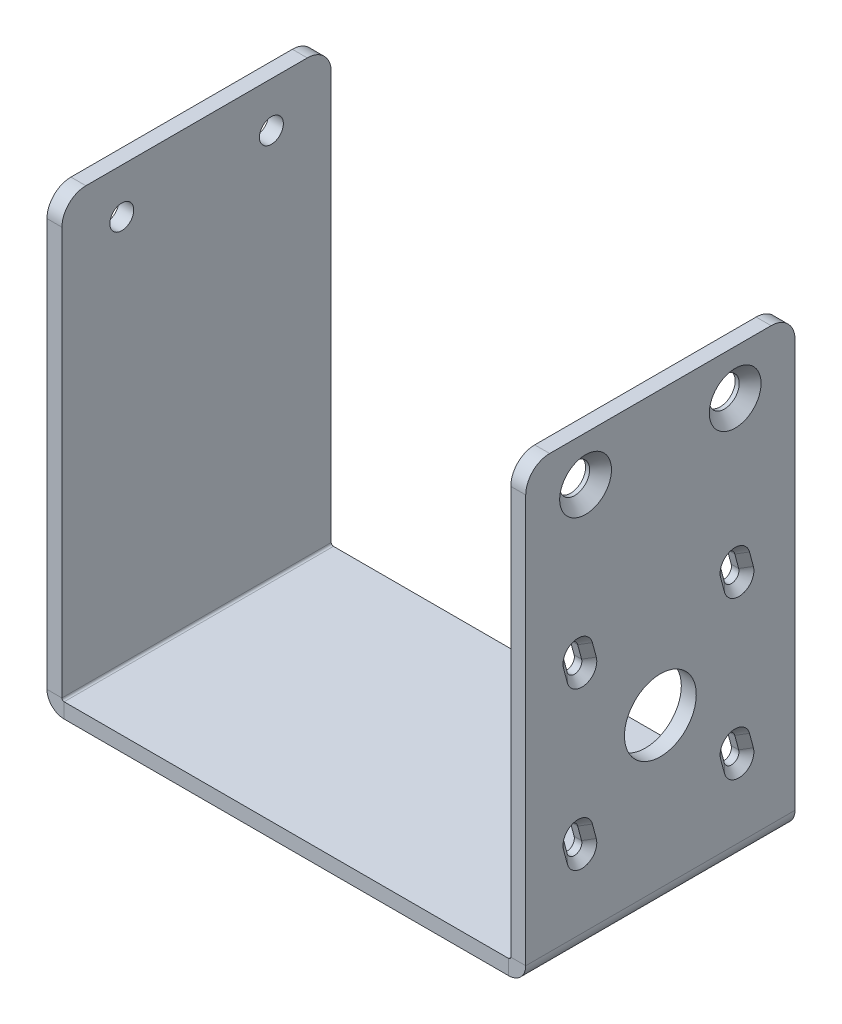
from build123d import *

# Parameters (mm, degrees)
SKETCH5_W                                       = 160
SKETCH5_H                                       = 90
BASE_FLANGE1_DEPTH                              = 5
EDGE_FLANGE1_STRIP_W                            = 21.4732
EDGE_FLANGE1_STRIP_H                            = 5
EDGE_FLANGE1_STRIP_CUT_DEPTH                    = 90
EDGE_FLANGE1_STRIP_2_W                          = 21.4732
EDGE_FLANGE1_STRIP_2_H                          = 5
EDGE_FLANGE1_STRIP_CUT_2_DEPTH                  = 90
EDGE_FLANGE1_DEPTH                              = 90
EDGE_FLANGE1_BEND_DEPTH                         = 90
CUT_EXTRUDE1_REACH                              = 235.934
SKETCH16_R                                      = 12
SKETCH16_R_2                                    = 4
CUT_EXTRUDE2_REACH                              = 232.543
SKETCH20_R                                      = 4
CSK_FOR_M8_FLAT_HEAD_MACHINE_SCREW1_D           = 10
CSK_FOR_M8_FLAT_HEAD_MACHINE_SCREW1_DEPTH       = 10.25
CSK_FOR_M8_FLAT_HEAD_MACHINE_SCREW1_CSINK_D     = 17.3
CSK_FOR_M8_FLAT_HEAD_MACHINE_SCREW1_CSINK_ANGLE = 90
CSK_FOR_M8_FLAT_HEAD_MACHINE_SCREW1_TIP         = 3.004303095
BREAK_CORNER1_DEPTH                             = 160
CHAMFER2_SIZE                                   = 2.5


# Read off the part's stored shape, not the designer's step: Break-Corner1
# Sheet-metal steps are written as plain solids
with BuildPart() as part:
    # Sketch5 → Base-Flange1 (new body)
    with BuildSketch(Plane(origin=(0, 0, 0), x_dir=(1, 0, 0), z_dir=(0, 1, 0))):
        with Locations((80, 45)):
            Rectangle(SKETCH5_W, SKETCH5_H)
    extrude(amount=-BASE_FLANGE1_DEPTH)

    # Edge-Flange1 strip (across the edge) → Edge-Flange1 strip cut (cut)
    with BuildSketch(Plane.XY.offset(-90)):
        with Locations((-5, -2.5)):
            Rectangle(EDGE_FLANGE1_STRIP_W, EDGE_FLANGE1_STRIP_H)
    extrude(amount=EDGE_FLANGE1_STRIP_CUT_DEPTH, mode=Mode.SUBTRACT)

    # Edge-Flange1 strip 2 (across the edge) → Edge-Flange1 strip cut 2 (cut)
    with BuildSketch(Plane(origin=(160, 0, 0), x_dir=(-1, 0, 0), z_dir=(0, 0, -1))):
        with Locations((-5, -2.5)):
            Rectangle(EDGE_FLANGE1_STRIP_2_W, EDGE_FLANGE1_STRIP_2_H)
    extrude(amount=EDGE_FLANGE1_STRIP_CUT_2_DEPTH, mode=Mode.SUBTRACT)

    # Edge-Flange1 section (across the edge) → Edge-Flange1 (add)
    with BuildSketch(Plane.XY.offset(-90)):
        with BuildLine():
            Line((0, 0.7366), (0, 145))
            Line((0, 145), (5, 145))
            Line((5, 145), (5, 0.7366))
            ThreePointArc((5, 0.7366), (5.215745145, 0.215745145), (5.7366, 0))
            Line((5.7366, 0), (5.7366, -5))
            ThreePointArc((5.7366, -5), (1.680211239, -3.319788761), (0, 0.7366))
        make_face()
    extrude(amount=EDGE_FLANGE1_DEPTH)

    # Edge-Flange1 section 2 (across the edge) → Edge-Flange1 bend (add)
    with BuildSketch(Plane(origin=(160, 0, 0), x_dir=(-1, 0, 0), z_dir=(0, 0, -1))):
        with BuildLine():
            Line((0, 0.7366), (0, 145))
            Line((0, 145), (5, 145))
            Line((5, 145), (5, 0.7366))
            ThreePointArc((5, 0.7366), (5.215745145, 0.215745145), (5.7366, 0))
            Line((5.7366, 0), (5.7366, -5))
            ThreePointArc((5.7366, -5), (1.680211239, -3.319788761), (0, 0.7366))
        make_face()
    extrude(amount=EDGE_FLANGE1_BEND_DEPTH)

    # Sketch16 → Cut-Extrude1 (cut, up to next)
    with BuildSketch(Plane(origin=(160, 0, 0), x_dir=(0, 0, -1), z_dir=(1, 0, 0)), mode=Mode.PRIVATE) as cut_extrude1_sk1:
        with Locations(Location((45, 50.7366, 0), (0, 0, 90))):
            Circle(SKETCH16_R)
    cut_extrude1_tool1 = extrude(cut_extrude1_sk1.sketch, amount=-CUT_EXTRUDE1_REACH, mode=Mode.PRIVATE) & part.part
    # Sketch16 → Cut-Extrude1 (cut, up to next)
    with BuildSketch(Plane(origin=(160, 0, 0), x_dir=(0, 0, -1), z_dir=(1, 0, 0)), mode=Mode.PRIVATE) as cut_extrude1_sk2:
        with Locations(Location((20, 130, 0), (0, 0, 90))):
            Circle(SKETCH16_R_2)
    cut_extrude1_tool2 = extrude(cut_extrude1_sk2.sketch, amount=-CUT_EXTRUDE1_REACH, mode=Mode.PRIVATE) & part.part
    # Sketch16 → Cut-Extrude1 (cut, up to next)
    with BuildSketch(Plane(origin=(160, 0, 0), x_dir=(0, 0, -1), z_dir=(1, 0, 0)), mode=Mode.PRIVATE) as cut_extrude1_sk3:
        with Locations(Location((70, 130, 0), (0, 0, 270))):
            Circle(SKETCH16_R_2)
    cut_extrude1_tool3 = extrude(cut_extrude1_sk3.sketch, amount=-CUT_EXTRUDE1_REACH, mode=Mode.PRIVATE) & part.part
    # Sketch16 → Cut-Extrude1 (cut, up to next)
    with BuildSketch(Plane(origin=(160, 0, 0), x_dir=(0, 0, -1), z_dir=(1, 0, 0)), mode=Mode.PRIVATE) as cut_extrude1_sk4:
        with BuildLine():
            Line((16.334822748, 23.840907472), (15.043437692, 28.671261976))
            ThreePointArc((15.043437692, 28.671261976), (16.812922416, 31.732131756), (19.873792196, 29.962647032))
            Line((19.873792196, 29.962647032), (21.165177252, 25.132292528))
            ThreePointArc((21.165177252, 25.132292528), (19.395692528, 22.071422748), (16.334822748, 23.840907472))
        make_face()
    cut_extrude1_tool4 = extrude(cut_extrude1_sk4.sketch, amount=-CUT_EXTRUDE1_REACH, mode=Mode.PRIVATE) & part.part
    # Sketch16 → Cut-Extrude1 (cut, up to next)
    with BuildSketch(Plane(origin=(160, 0, 0), x_dir=(0, 0, -1), z_dir=(1, 0, 0)), mode=Mode.PRIVATE) as cut_extrude1_sk5:
        with BuildLine():
            Line((68.834822748, 23.840907472), (67.543437692, 28.671261976))
            ThreePointArc((67.543437692, 28.671261976), (69.312922416, 31.732131756), (72.373792196, 29.962647032))
            Line((72.373792196, 29.962647032), (73.665177252, 25.132292528))
            ThreePointArc((73.665177252, 25.132292528), (71.895692528, 22.071422748), (68.834822748, 23.840907472))
        make_face()
    cut_extrude1_tool5 = extrude(cut_extrude1_sk5.sketch, amount=-CUT_EXTRUDE1_REACH, mode=Mode.PRIVATE) & part.part
    # Sketch16 → Cut-Extrude1 (cut, up to next)
    with BuildSketch(Plane(origin=(160, 0, 0), x_dir=(0, 0, -1), z_dir=(1, 0, 0)), mode=Mode.PRIVATE) as cut_extrude1_sk6:
        with BuildLine():
            Line((16.334822748, 76.340907472), (15.043437692, 81.171261976))
            ThreePointArc((15.043437692, 81.171261976), (16.812922416, 84.232131756), (19.873792196, 82.462647032))
            Line((19.873792196, 82.462647032), (21.165177252, 77.632292528))
            ThreePointArc((21.165177252, 77.632292528), (19.395692528, 74.571422748), (16.334822748, 76.340907472))
        make_face()
    cut_extrude1_tool6 = extrude(cut_extrude1_sk6.sketch, amount=-CUT_EXTRUDE1_REACH, mode=Mode.PRIVATE) & part.part
    # Sketch16 → Cut-Extrude1 (cut, up to next)
    with BuildSketch(Plane(origin=(160, 0, 0), x_dir=(0, 0, -1), z_dir=(1, 0, 0)), mode=Mode.PRIVATE) as cut_extrude1_sk7:
        with BuildLine():
            Line((68.834822748, 76.340907472), (67.543437692, 81.171261976))
            ThreePointArc((67.543437692, 81.171261976), (69.312922416, 84.232131756), (72.373792196, 82.462647032))
            Line((72.373792196, 82.462647032), (73.665177252, 77.632292528))
            ThreePointArc((73.665177252, 77.632292528), (71.895692528, 74.571422748), (68.834822748, 76.340907472))
        make_face()
    cut_extrude1_tool7 = extrude(cut_extrude1_sk7.sketch, amount=-CUT_EXTRUDE1_REACH, mode=Mode.PRIVATE) & part.part
    add(cut_extrude1_tool1.solids().sort_by_distance((160, 50.7366, -45))[0], mode=Mode.SUBTRACT)
    add(cut_extrude1_tool2.solids().sort_by_distance((160, 130, -20))[0], mode=Mode.SUBTRACT)
    add(cut_extrude1_tool3.solids().sort_by_distance((160, 130, -70))[0], mode=Mode.SUBTRACT)
    add(cut_extrude1_tool4.solids().sort_by_distance((160, 26.901777, -18.104307))[0], mode=Mode.SUBTRACT)
    add(cut_extrude1_tool5.solids().sort_by_distance((160, 26.901777, -70.604307))[0], mode=Mode.SUBTRACT)
    add(cut_extrude1_tool6.solids().sort_by_distance((160, 79.401777, -18.104307))[0], mode=Mode.SUBTRACT)
    add(cut_extrude1_tool7.solids().sort_by_distance((160, 79.401777, -70.604307))[0], mode=Mode.SUBTRACT)

    # Sketch20 → Cut-Extrude2 (cut, up to next)
    with BuildSketch(Plane(origin=(5, 0, 0), x_dir=(0, 0, -1), z_dir=(1, 0, 0)), mode=Mode.PRIVATE) as cut_extrude2_sk1:
        with Locations(Location((70, 130, 0), (0, 0, 270))):
            Circle(SKETCH20_R)
    cut_extrude2_tool1 = extrude(cut_extrude2_sk1.sketch, amount=-CUT_EXTRUDE2_REACH, mode=Mode.PRIVATE) & part.part
    # Sketch20 → Cut-Extrude2 (cut, up to next)
    with BuildSketch(Plane(origin=(5, 0, 0), x_dir=(0, 0, -1), z_dir=(1, 0, 0)), mode=Mode.PRIVATE) as cut_extrude2_sk2:
        with Locations(Location((20, 130, 0), (0, 0, 90))):
            Circle(SKETCH20_R)
    cut_extrude2_tool2 = extrude(cut_extrude2_sk2.sketch, amount=-CUT_EXTRUDE2_REACH, mode=Mode.PRIVATE) & part.part
    add(cut_extrude2_tool1.solids().sort_by_distance((5, 130, -70))[0], mode=Mode.SUBTRACT)
    add(cut_extrude2_tool2.solids().sort_by_distance((5, 130, -20))[0], mode=Mode.SUBTRACT)

    # CSK for M8 Flat Head Machine Screw1
    with Locations(Plane(origin=(160, 0, 0), x_dir=(0, 0, -1), z_dir=(1, 0, 0))):
        with Locations((20, 130), (70, 130)):
            CounterSinkHole(CSK_FOR_M8_FLAT_HEAD_MACHINE_SCREW1_D / 2, CSK_FOR_M8_FLAT_HEAD_MACHINE_SCREW1_CSINK_D / 2, depth=CSK_FOR_M8_FLAT_HEAD_MACHINE_SCREW1_DEPTH, counter_sink_angle=CSK_FOR_M8_FLAT_HEAD_MACHINE_SCREW1_CSINK_ANGLE)
            with Locations((0, 0, -(CSK_FOR_M8_FLAT_HEAD_MACHINE_SCREW1_DEPTH + CSK_FOR_M8_FLAT_HEAD_MACHINE_SCREW1_TIP / 2))):  # 118° drill point
                Cone(0, CSK_FOR_M8_FLAT_HEAD_MACHINE_SCREW1_D / 2, CSK_FOR_M8_FLAT_HEAD_MACHINE_SCREW1_TIP, mode=Mode.SUBTRACT)

    # Break-Corner1 outline → Break-Corner1 (cut)
    with BuildSketch(Plane.YZ):
        with BuildLine():
            Line((145, -90), (145, -82))
            ThreePointArc((145, -82), (142.656854249, -87.656854249), (137, -90))
            Line((137, -90), (145, -90))
        make_face()
        with BuildLine():
            ThreePointArc((137, 0), (142.656854249, -2.343145751), (145, -8))
            Line((145, -8), (145, 0))
            Line((145, 0), (137, 0))
        make_face()
    extrude(amount=BREAK_CORNER1_DEPTH, mode=Mode.SUBTRACT)

    # Chamfer2
    chamfer2_edges = [part.edges().sort_by_distance(p)[0] for p in [
        (160, 22.071422748, -19.395692528),
        (160, 27.54746978, -20.519484724),
        (160, 31.732131756, -16.812922416),
        (160, 26.256084724, -15.68913022),
        (160, 22.071422748, -71.895692528),
        (160, 27.54746978, -73.019484724),
        (160, 31.732131756, -69.312922416),
        (160, 26.256084724, -68.18913022),
        (160, 74.571422748, -19.395692528),
        (160, 80.04746978, -20.519484724),
        (160, 84.232131756, -16.812922416),
        (160, 78.756084724, -15.68913022),
        (160, 74.571422748, -71.895692528),
        (160, 80.04746978, -73.019484724),
        (160, 84.232131756, -69.312922416),
        (160, 78.756084724, -68.18913022),
    ]]
    chamfer(chamfer2_edges, length=CHAMFER2_SIZE)


solid = part.part
